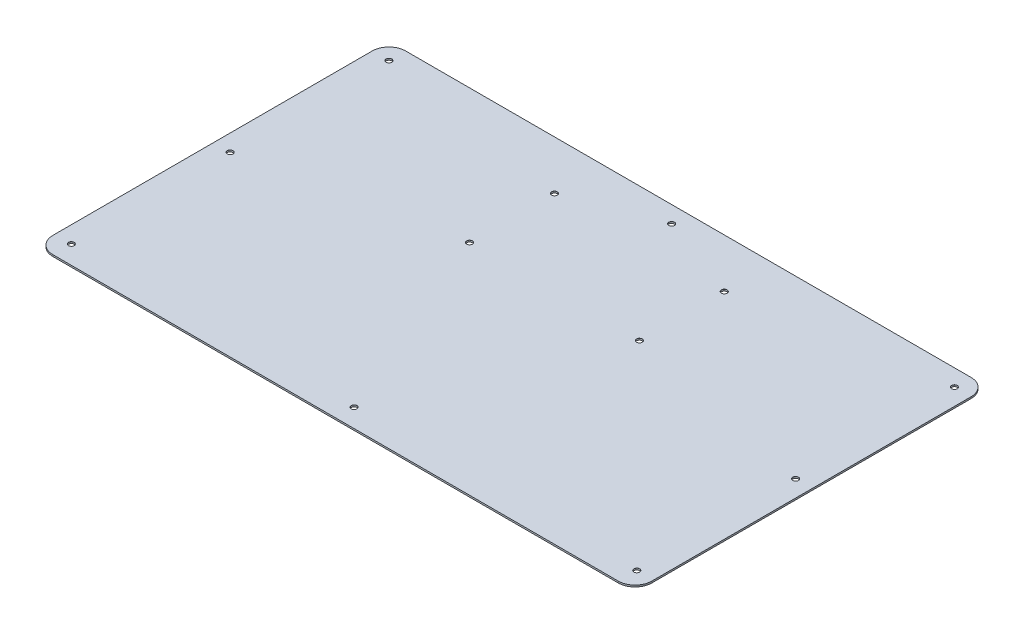
from build123d import *

# Parameters (mm, degrees)
SKETCH1_W                     = 358.27
SKETCH1_H                     = 211.05
BOSS_EXTRUDE1_DEPTH           = 1
FILLET1_R                     = 10
M3_CLEARANCE_HOLE1_AT_2_COUNT = 2
M3_CLEARANCE_HOLE1_AT_2_PITCH = 95
M3_CLEARANCE_HOLE1_AT_3_COUNT = 2
M3_CLEARANCE_HOLE1_AT_3_PITCH = 95
M3_CLEARANCE_HOLE1_AT_4_COUNT = 2
M3_CLEARANCE_HOLE1_AT_4_PITCH = 193.988783761
M3_CLEARANCE_HOLE1_AT_5_COUNT = 2
M3_CLEARANCE_HOLE1_AT_5_PITCH = 351.356788607
M3_CLEARANCE_HOLE1_AT_6_COUNT = 2
M3_CLEARANCE_HOLE1_AT_6_PITCH = 338.27
M3_CLEARANCE_HOLE1_AT_7_COUNT = 2
M3_CLEARANCE_HOLE1_AT_7_PITCH = 351.356788607
M3_CLEARANCE_HOLE1_AT_8_COUNT = 2
M3_CLEARANCE_HOLE1_AT_8_PITCH = 193.988783761
M3_CLEARANCE_HOLE3_AT_2_COUNT = 2
M3_CLEARANCE_HOLE3_AT_2_PITCH = 50.8
M3_CLEARANCE_HOLE3_AT_3_COUNT = 2
M3_CLEARANCE_HOLE3_AT_3_PITCH = 101.6
M3_CLEARANCE_HOLE3_AT_4_COUNT = 2
M3_CLEARANCE_HOLE3_AT_4_PITCH = 113.592253257


with BuildPart() as part:
    # Sketch1 → Boss-Extrude1 (new body)
    with BuildSketch(Plane(origin=(0, 0, 0), x_dir=(1, 0, 0), z_dir=(0, 1, 0))):
        Rectangle(SKETCH1_W, SKETCH1_H)
    extrude(amount=BOSS_EXTRUDE1_DEPTH)

    # Fillet1
    fillet1_edges = [part.edges().sort_by_distance(p)[0] for p in [
        (-179.135, 0.5, -105.525),
        (-179.135, 0.5, 105.525),
        (179.135, 0.5, -105.525),
        (179.135, 0.5, 105.525),
    ]]
    fillet(fillet1_edges, radius=FILLET1_R)

    # Sketch3 → M3 Clearance Hole1 (revolve, cut)
    with BuildSketch(Plane(origin=(169.135, 1, -0.525), x_dir=(0, 0, 1), z_dir=(1, 0, 0))):
        Polygon((0, 0), (0, 1), (1.7, 1), (1.7, 0.025), (1.725, 0), align=None)
    m3_clearance_hole1 = revolve(axis=Axis((169.135, 7.35, -0.525), (0, -1, 0)), mode=Mode.SUBTRACT)

    # M3 Clearance Hole1 at 2: M3 Clearance Hole1 ×2
    with Locations(*[(0, 0, i * M3_CLEARANCE_HOLE1_AT_2_PITCH) for i in range(1, M3_CLEARANCE_HOLE1_AT_2_COUNT)]):
        add(m3_clearance_hole1, mode=Mode.SUBTRACT)

    # M3 Clearance Hole1 at 3: M3 Clearance Hole1 ×2
    with Locations(*[(0, 0, -i * M3_CLEARANCE_HOLE1_AT_3_PITCH) for i in range(1, M3_CLEARANCE_HOLE1_AT_3_COUNT)]):
        add(m3_clearance_hole1, mode=Mode.SUBTRACT)

    # M3 Clearance Hole1 at 4: M3 Clearance Hole1 ×2
    with Locations(*[Vector(-0.871880305247654, 0, -0.48971903508160447) * (i * M3_CLEARANCE_HOLE1_AT_4_PITCH) for i in range(1, M3_CLEARANCE_HOLE1_AT_4_COUNT)]):
        add(m3_clearance_hole1, mode=Mode.SUBTRACT)

    # M3 Clearance Hole1 at 5: M3 Clearance Hole1 ×2
    with Locations(*[Vector(-0.9627535626717865, 0, -0.2703804311757465) * (i * M3_CLEARANCE_HOLE1_AT_5_PITCH) for i in range(1, M3_CLEARANCE_HOLE1_AT_5_COUNT)]):
        add(m3_clearance_hole1, mode=Mode.SUBTRACT)

    # M3 Clearance Hole1 at 6: M3 Clearance Hole1 ×2
    with Locations(*[(-i * M3_CLEARANCE_HOLE1_AT_6_PITCH, 0, 0) for i in range(1, M3_CLEARANCE_HOLE1_AT_6_COUNT)]):
        add(m3_clearance_hole1, mode=Mode.SUBTRACT)

    # M3 Clearance Hole1 at 7: M3 Clearance Hole1 ×2
    with Locations(*[Vector(-0.9627535626717866, 0, 0.27038043117574606) * (i * M3_CLEARANCE_HOLE1_AT_7_PITCH) for i in range(1, M3_CLEARANCE_HOLE1_AT_7_COUNT)]):
        add(m3_clearance_hole1, mode=Mode.SUBTRACT)

    # M3 Clearance Hole1 at 8: M3 Clearance Hole1 ×2
    with Locations(*[Vector(-0.8718803052476543, 0, 0.48971903508160397) * (i * M3_CLEARANCE_HOLE1_AT_8_PITCH) for i in range(1, M3_CLEARANCE_HOLE1_AT_8_COUNT)]):
        add(m3_clearance_hole1, mode=Mode.SUBTRACT)

    # Sketch5 → M3 Clearance Hole3 (revolve, cut)
    with BuildSketch(Plane(origin=(50.8, 1, -25.4), x_dir=(0, 0, 1), z_dir=(1, 0, 0))):
        Polygon((0, 0), (0, 1), (1.7, 1), (1.7, 0.025), (1.725, 0), align=None)
    m3_clearance_hole3 = revolve(axis=Axis((50.8, 7.35, -25.4), (0, -1, 0)), mode=Mode.SUBTRACT)

    # M3 Clearance Hole3 at 2: M3 Clearance Hole3 ×2
    with Locations(*[(0, 0, -i * M3_CLEARANCE_HOLE3_AT_2_PITCH) for i in range(1, M3_CLEARANCE_HOLE3_AT_2_COUNT)]):
        add(m3_clearance_hole3, mode=Mode.SUBTRACT)

    # M3 Clearance Hole3 at 3: M3 Clearance Hole3 ×2
    with Locations(*[(-i * M3_CLEARANCE_HOLE3_AT_3_PITCH, 0, 0) for i in range(1, M3_CLEARANCE_HOLE3_AT_3_COUNT)]):
        add(m3_clearance_hole3, mode=Mode.SUBTRACT)

    # M3 Clearance Hole3 at 4: M3 Clearance Hole3 ×2
    with Locations(*[Vector(-0.894427190999916, 0, -0.4472135954999579) * (i * M3_CLEARANCE_HOLE3_AT_4_PITCH) for i in range(1, M3_CLEARANCE_HOLE3_AT_4_COUNT)]):
        add(m3_clearance_hole3, mode=Mode.SUBTRACT)


solid = part.part
